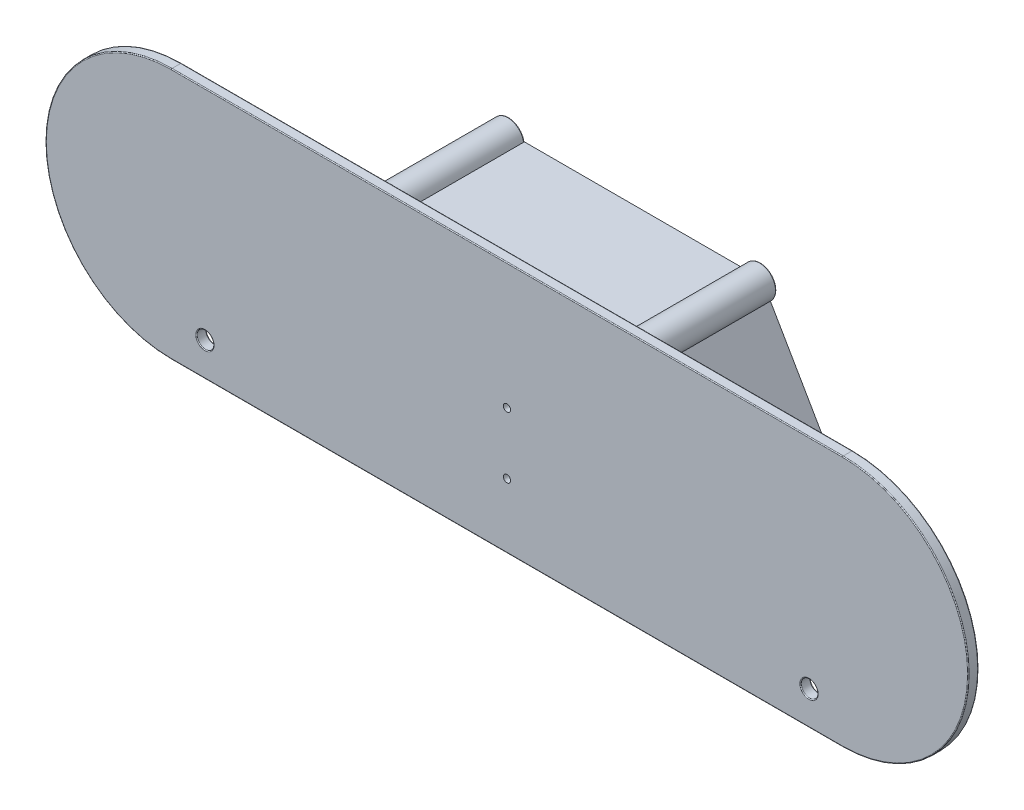
from build123d import *

# Parameters (mm, degrees)
SKETCH1_R           = 2.5
BOSS_EXTRUDE2_DEPTH = 3
SKETCH1_4_R         = 4.75
SKETCH1_4_R_2       = 2.5
EXTRUDE_THIN1_DEPTH = 35
FILLET2_R           = 0.25
FILLET3_R           = 0.25
RIB1_START          = -35
RIB1_OUTLINE_R      = 2.75
RIB1_DEPTH          = 35
SKETCH4_R           = 1.075
CUT_EXTRUDE1_DEPTH  = 147.756601264
CUT_EXTRUDE5_START  = -35
CUT_EXTRUDE5_DEPTH  = 35
FILLET5_R           = 0.25


with BuildPart() as part:
    # Sketch1 → Boss-Extrude2 (new body)
    # profile 1 of 5: a face of its own
    with BuildSketch(Plane.XY):
        with BuildLine():
            Line((-100, -37.5), (100, -37.5))
            ThreePointArc((100, -37.5), (137.5, 0), (100, 37.5))
            Line((100, 37.5), (-100, 37.5))
            ThreePointArc((-100, 37.5), (-137.5, 0), (-100, -37.5))
        make_face()
        with Locations((-75, -32.5)):
            Circle(SKETCH1_R, mode=Mode.SUBTRACT)
        with Locations((37.5, 32.5)):
            Circle(SKETCH1_R, mode=Mode.SUBTRACT)
        with Locations((75, -32.5)):
            Circle(SKETCH1_R, mode=Mode.SUBTRACT)
        with Locations((90, -27.5)):
            Circle(SKETCH1_R, mode=Mode.SUBTRACT)
        with Locations((-90, -27.5)):
            Circle(SKETCH1_R, mode=Mode.SUBTRACT)
        with Locations((-37.5, 32.5)):
            Circle(SKETCH1_R, mode=Mode.SUBTRACT)
    # profile 2 of 5: a face of its own
    with BuildSketch(Plane.XY):
        with Locations((-37.5, 32.5)):
            Circle(SKETCH1_R)
    # profile 3 of 5: a face of its own
    with BuildSketch(Plane.XY):
        with Locations((37.5, 32.5)):
            Circle(SKETCH1_R)
    # profile 4 of 5: a face of its own
    with BuildSketch(Plane.XY):
        with Locations((75, -32.5)):
            Circle(SKETCH1_R)
    # profile 5 of 5: a face of its own
    with BuildSketch(Plane.XY):
        with Locations((-75, -32.5)):
            Circle(SKETCH1_R)
    extrude(amount=BOSS_EXTRUDE2_DEPTH)

    # Sketch1<4> → Extrude-Thin1 (add)
    # profile 1 of 4: a face of its own
    with BuildSketch(Plane.XY):
        with Locations((75, -32.5)):
            Circle(SKETCH1_4_R)
        with Locations((75, -32.5)):
            Circle(SKETCH1_4_R_2, mode=Mode.SUBTRACT)
    # profile 2 of 4: a face of its own
    with BuildSketch(Plane.XY):
        with Locations((37.5, 32.5)):
            Circle(SKETCH1_4_R)
        with Locations((37.5, 32.5)):
            Circle(SKETCH1_4_R_2, mode=Mode.SUBTRACT)
    # profile 3 of 4: a face of its own
    with BuildSketch(Plane.XY):
        with Locations((-75, -32.5)):
            Circle(SKETCH1_4_R)
        with Locations((-75, -32.5)):
            Circle(SKETCH1_4_R_2, mode=Mode.SUBTRACT)
    # profile 4 of 4: a face of its own
    with BuildSketch(Plane.XY):
        with Locations((-37.5, 32.5)):
            Circle(SKETCH1_4_R)
        with Locations((-37.5, 32.5)):
            Circle(SKETCH1_4_R_2, mode=Mode.SUBTRACT)
    extrude(amount=-EXTRUDE_THIN1_DEPTH)

    # Fillet2
    fillet2_edges = [part.edges().sort_by_distance(p)[0] for p in [
        (0, -37.5, 0),
        (137.5, 0, 3),
        (0, 37.5, 3),
        (-79.75, -32.5, -35),
        (-137.5, 0, 3),
        (-77.5, -32.5, -35),
        (87.5, -27.5, 3),
        (70.25, -32.5, -35),
        (72.5, -32.5, -35),
        (-92.5, -27.5, 3),
        (32.75, 32.5, -35),
        (35, 32.5, -35),
        (-42.25, 32.5, -35),
        (-40, 32.5, -35),
        (0, -37.5, 3),
        (-137.5, 0, 0),
        (0, 37.5, 0),
        (137.5, 0, 0),
    ]]
    fillet(fillet2_edges, radius=FILLET2_R - 0.0001)  # a hair under: the kernel refuses the full size

    # Fillet3
    fillet3_edges = [part.edges().sort_by_distance(p)[0] for p in [
        (-79.75, -32.5, 0),
        (70.25, -32.5, 0),
        (32.75, 32.5, 0),
        (-42.25, 32.5, 0),
        (-92.5, -27.5, 0),
        (87.5, -27.5, 0),
    ]]
    fillet(fillet3_edges, radius=FILLET3_R)

    # Rib1: read off the stored shape, not the designer's step
    # Rib1 outline → Rib1 (add)
    with BuildSketch(Plane(origin=(0, 0, -35), x_dir=(-1, 0, 0), z_dir=(0, 0, -1)).offset(RIB1_START)):
        with BuildLine():
            ThreePointArc((40.366937618, 29.031474565), (39.750624393, 36.396753757), (33.062940163, 33.25))
            Line((33.062940163, 33.25), (-33.062940163, 33.25))
            ThreePointArc((-33.062940163, 33.25), (-39.750624393, 36.396753757), (-40.366937618, 29.031474565))
            Line((-40.366937618, 29.031474565), (-73.432340761, -28.281890884))
            ThreePointArc((-73.432340761, -28.281890884), (-78.896753757, -34.750624393), (-70.562940163, -33.25))
            Line((-70.562940163, -33.25), (70.562940163, -33.25))
            ThreePointArc((70.562940163, -33.25), (78.896753757, -34.750624393), (73.432340761, -28.281890884))
            Line((73.432340761, -28.281890884), (40.366937618, 29.031474565))
        make_face()
        with BuildLine():
            Line((39.067659239, 28.281890884), (72.133062382, -29.031474565))
            ThreePointArc((72.133062382, -29.031474565), (71.103246243, -30.249375607), (70.562940163, -31.75))
            Line((70.562940163, -31.75), (-70.562940163, -31.75))
            ThreePointArc((-70.562940163, -31.75), (-71.103246243, -30.249375607), (-72.133062382, -29.031474565))
            Line((-72.133062382, -29.031474565), (-39.067659239, 28.281890884))
            ThreePointArc((-39.067659239, 28.281890884), (-35.249375607, 28.603246243), (-33.062940163, 31.75))
            Line((-33.062940163, 31.75), (33.062940163, 31.75))
            ThreePointArc((33.062940163, 31.75), (35.249375607, 28.603246243), (39.067659239, 28.281890884))
        make_face(mode=Mode.SUBTRACT)
        with Locations((37.5, 32.5)):
            Circle(RIB1_OUTLINE_R, mode=Mode.SUBTRACT)
        with BuildLine():
            ThreePointArc((77.645751311, -33.25), (75, -35.25), (72.354248689, -33.25))
            Line((72.354248689, -33.25), (77.645751311, -33.25))
        make_face(mode=Mode.SUBTRACT)
        with BuildLine():
            Line((77.645751311, -31.75), (72.354248689, -31.75))
            ThreePointArc((72.354248689, -31.75), (75, -29.75), (77.645751311, -31.75))
        make_face(mode=Mode.SUBTRACT)
        with Locations((-37.5, 32.5)):
            Circle(RIB1_OUTLINE_R, mode=Mode.SUBTRACT)
        with Locations((-75, -32.5)):
            Circle(RIB1_OUTLINE_R, mode=Mode.SUBTRACT)
    extrude(amount=RIB1_DEPTH)

    # Sketch4 → Cut-Extrude1 (cut, through all)
    with BuildSketch(Plane(origin=(0, 0, 0), x_dir=(-1, 0, 0), z_dir=(0, 0, -1))):
        Circle(SKETCH4_R)
        with Locations((0, -18.25)):
            Circle(SKETCH4_R)
    extrude(amount=-CUT_EXTRUDE1_DEPTH, mode=Mode.SUBTRACT)

    # Sketch7 → Cut-Extrude5 (cut)
    with BuildSketch(Plane(origin=(0, 0, -35), x_dir=(-1, 0, 0), z_dir=(0, 0, -1)).offset(CUT_EXTRUDE5_START)):
        with BuildLine():
            Line((72.615151996, -31.75), (77.384848004, -31.75))
            ThreePointArc((77.384848004, -31.75), (77.5, -32.5), (77.384848004, -33.25))
            Line((77.384848004, -33.25), (72.615151996, -33.25))
            ThreePointArc((72.615151996, -33.25), (72.5, -32.5), (72.615151996, -31.75))
        make_face()
    extrude(amount=CUT_EXTRUDE5_DEPTH, mode=Mode.SUBTRACT)

    # Fillet5
    # the kernel refuses this fillet: 0.25 mm, written as the material it takes off along each edge
    with BuildSketch(Plane(origin=(-75, -32.5, -35), x_dir=(-0.8500543952814934, 0.5266949070027303, 0), z_dir=(0.5266949070027303, 0.8500543952814934, 0))) as fillet5_piece_1:
        with BuildLine():
            CenterArc((2.5 + FILLET5_R, FILLET5_R), FILLET5_R, 180, 90)
            Line((2.5, FILLET5_R), (2.5 - FILLET5_R * 0.02, FILLET5_R))
            Line((2.5 - FILLET5_R * 0.02, FILLET5_R), (2.5 - FILLET5_R * 0.02, -FILLET5_R * 0.02))
            Line((2.5 - FILLET5_R * 0.02, -FILLET5_R * 0.02), (2.5 + FILLET5_R, -FILLET5_R * 0.02))
            Line((2.5 + FILLET5_R, -FILLET5_R * 0.02), (2.5 + FILLET5_R, 0))
        make_face()
    revolve(axis=Axis((-75, -32.5, -35), (0, 0, 1)), revolution_arc=63.564827589, mode=Mode.SUBTRACT)
    # the kernel refuses this fillet: 0.25 mm, written as the material it takes off along each edge
    with BuildSketch(Plane(origin=(-75, -32.5, -35), x_dir=(0.8500543952814934, -0.5266949070027303, 0), z_dir=(-0.5266949070027303, -0.8500543952814934, 0))) as fillet5_2_piece_1:
        with BuildLine():
            CenterArc((2.5 + FILLET5_R, FILLET5_R), FILLET5_R, 180, 90)
            Line((2.5, FILLET5_R), (2.5 - FILLET5_R * 0.02, FILLET5_R))
            Line((2.5 - FILLET5_R * 0.02, FILLET5_R), (2.5 - FILLET5_R * 0.02, -FILLET5_R * 0.02))
            Line((2.5 - FILLET5_R * 0.02, -FILLET5_R * 0.02), (2.5 + FILLET5_R, -FILLET5_R * 0.02))
            Line((2.5 + FILLET5_R, -FILLET5_R * 0.02), (2.5 + FILLET5_R, 0))
        make_face()
    revolve(axis=Axis((-75, -32.5, -35), (0, 0, 1)), revolution_arc=63.564827589, mode=Mode.SUBTRACT)


solid = part.part
